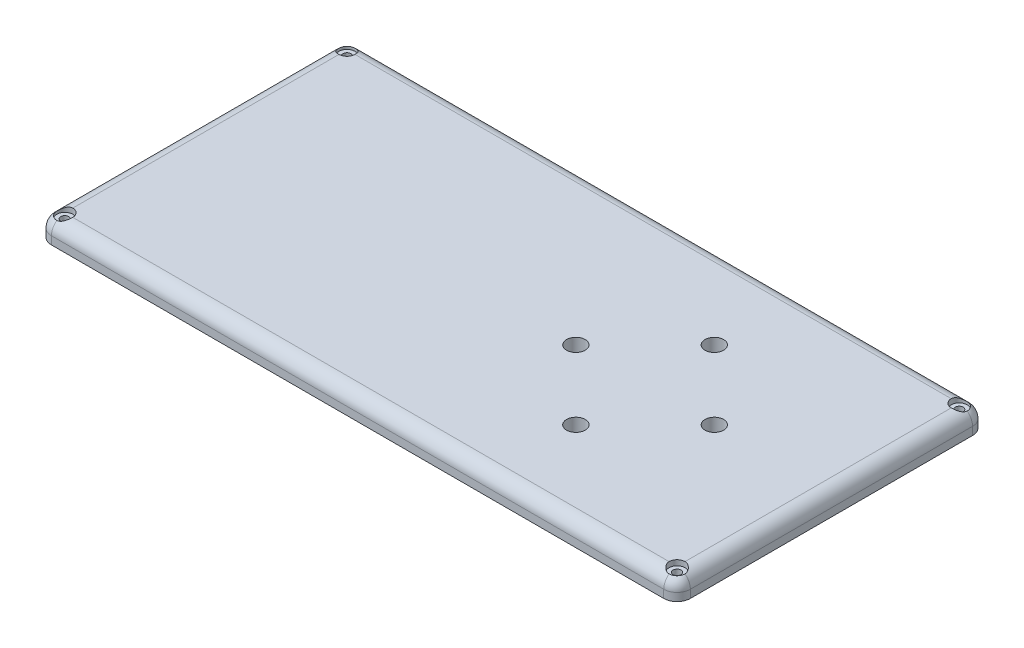
from build123d import *

# Parameters (mm, degrees)
SKETCH1_W           = 240
SKETCH1_H           = 116
BOSS_EXTRUDE1_DEPTH = 8
FILLET1_R           = 5
CUT_EXTRUDE1_REACH  = 135.522
SKETCH2_R           = 1.5
FILLET2_R           = 5
SKETCH3_R           = 3
SKETCH3_R_2         = 1.5
CUT_EXTRUDE2_DEPTH  = 2
SHELL1_DEPTH        = 3
SHELL1_2_DEPTH      = 1
CUT_EXTRUDE3_REACH  = 135.522
SKETCH4_R           = 3.5


# Read off the part's stored shape, not the designer's step: Shell1
with BuildPart() as part:
    # Sketch1 → Boss-Extrude1 (new body)
    with BuildSketch(Plane(origin=(0, 0, 0), x_dir=(1, 0, 0), z_dir=(0, 1, 0))):
        Rectangle(SKETCH1_W, SKETCH1_H)
    extrude(amount=BOSS_EXTRUDE1_DEPTH)

    # Fillet1
    fillet1_edges = [part.edges().sort_by_distance(p)[0] for p in [
        (120, 4, 58),
        (-120, 4, 58),
        (-120, 4, -58),
        (120, 4, -58),
    ]]
    fillet(fillet1_edges, radius=FILLET1_R)

    # Sketch2 → Cut-Extrude1 (cut, up to next)
    with BuildSketch(Plane(origin=(0, 8, 0), x_dir=(1, 0, 0), z_dir=(0, 1, 0)), mode=Mode.PRIVATE) as cut_extrude1_sk1:
        with Locations(Location((-115, -53, 0), (0, 0, 270))):
            Circle(SKETCH2_R)
    cut_extrude1_tool1 = extrude(cut_extrude1_sk1.sketch, amount=-CUT_EXTRUDE1_REACH, mode=Mode.PRIVATE) & part.part
    # Sketch2 → Cut-Extrude1 (cut, up to next)
    with BuildSketch(Plane(origin=(0, 8, 0), x_dir=(1, 0, 0), z_dir=(0, 1, 0)), mode=Mode.PRIVATE) as cut_extrude1_sk2:
        with Locations(Location((-115, 53, 0), (0, 0, 270))):
            Circle(SKETCH2_R)
    cut_extrude1_tool2 = extrude(cut_extrude1_sk2.sketch, amount=-CUT_EXTRUDE1_REACH, mode=Mode.PRIVATE) & part.part
    # Sketch2 → Cut-Extrude1 (cut, up to next)
    with BuildSketch(Plane(origin=(0, 8, 0), x_dir=(1, 0, 0), z_dir=(0, 1, 0)), mode=Mode.PRIVATE) as cut_extrude1_sk3:
        with Locations(Location((115, 53, 0), (0, 0, 270))):
            Circle(SKETCH2_R)
    cut_extrude1_tool3 = extrude(cut_extrude1_sk3.sketch, amount=-CUT_EXTRUDE1_REACH, mode=Mode.PRIVATE) & part.part
    # Sketch2 → Cut-Extrude1 (cut, up to next)
    with BuildSketch(Plane(origin=(0, 8, 0), x_dir=(1, 0, 0), z_dir=(0, 1, 0)), mode=Mode.PRIVATE) as cut_extrude1_sk4:
        with Locations(Location((115, -53, 0), (0, 0, 270))):
            Circle(SKETCH2_R)
    cut_extrude1_tool4 = extrude(cut_extrude1_sk4.sketch, amount=-CUT_EXTRUDE1_REACH, mode=Mode.PRIVATE) & part.part
    add(cut_extrude1_tool1.solids().sort_by_distance((-115, 8, 53))[0], mode=Mode.SUBTRACT)
    add(cut_extrude1_tool2.solids().sort_by_distance((-115, 8, -53))[0], mode=Mode.SUBTRACT)
    add(cut_extrude1_tool3.solids().sort_by_distance((115, 8, -53))[0], mode=Mode.SUBTRACT)
    add(cut_extrude1_tool4.solids().sort_by_distance((115, 8, 53))[0], mode=Mode.SUBTRACT)

    # Fillet2
    # the kernel refuses this fillet: 5 mm, written as the material it takes off along each edge
    with BuildSketch(Plane(origin=(-115, 8, -58), x_dir=(0, -1, 0), z_dir=(1, 0, 0))) as fillet2_piece_1:
        with BuildLine():
            CenterArc((FILLET2_R, -FILLET2_R), FILLET2_R, 90, 90)
            Line((0, -FILLET2_R), (0, 0))
            Line((0, 0), (FILLET2_R, 0))
        make_face()
    extrude(amount=230, mode=Mode.SUBTRACT)
    with BuildSketch(Plane(origin=(120, 8, -53), x_dir=(-1, 0, 0), z_dir=(0, 0, 1)), Plane(origin=(-120, 8, 53), x_dir=(1, 0, 0), z_dir=(0, 0, -1))) as fillet2_piece_2:
        with BuildLine():
            CenterArc((FILLET2_R, FILLET2_R), FILLET2_R, 180, 90)
            Line((0, FILLET2_R), (0, 0))
            Line((0, 0), (FILLET2_R, 0))
        make_face()
    extrude(amount=106, mode=Mode.SUBTRACT)
    with BuildSketch(Plane(origin=(115, 8, 58), x_dir=(0, 0, -1), z_dir=(-1, 0, 0))) as fillet2_piece_3:
        with BuildLine():
            CenterArc((FILLET2_R, FILLET2_R), FILLET2_R, 180, 90)
            Line((0, FILLET2_R), (0, 0))
            Line((0, 0), (FILLET2_R, 0))
        make_face()
    extrude(amount=230, mode=Mode.SUBTRACT)
    with BuildSketch(Plane(origin=(-115, 8, 53), x_dir=(0, 0, 1), z_dir=(1, 0, 0))) as fillet2_piece_4:
        with BuildLine():
            CenterArc((5 - FILLET2_R, FILLET2_R), FILLET2_R, 270, 90)
            Line((5, FILLET2_R), (5, 0))
            Line((5, 0), (5 - FILLET2_R, 0))
        make_face()
    revolve(axis=Axis((-115, 8, 53), (0, -1, 0)), revolution_arc=90, mode=Mode.SUBTRACT)
    with BuildSketch(Plane(origin=(-115, 8, -53), x_dir=(0, 0, -1), z_dir=(1, 0, 0))) as fillet2_piece_5:
        with BuildLine():
            CenterArc((5 - FILLET2_R, -FILLET2_R), FILLET2_R, 0, 90)
            Line((5 - FILLET2_R, 0), (5, 0))
            Line((5, 0), (5, -FILLET2_R))
        make_face()
    revolve(axis=Axis((-115, 8, -53), (0, 1, 0)), revolution_arc=90, mode=Mode.SUBTRACT)
    with BuildSketch(Plane(origin=(115, 8, 53), x_dir=(1, 0, 0), z_dir=(0, 0, -1))) as fillet2_piece_6:
        with BuildLine():
            CenterArc((5 - FILLET2_R, FILLET2_R), FILLET2_R, 270, 90)
            Line((5, FILLET2_R), (5, 0))
            Line((5, 0), (5 - FILLET2_R, 0))
        make_face()
    revolve(axis=Axis((115, 8, 53), (0, -1, 0)), revolution_arc=90, mode=Mode.SUBTRACT)
    with BuildSketch(Plane(origin=(115, 8, -53), x_dir=(0, 0, -1), z_dir=(-1, 0, 0))) as fillet2_piece_7:
        with BuildLine():
            CenterArc((5 - FILLET2_R, FILLET2_R), FILLET2_R, 270, 90)
            Line((5 - FILLET2_R, 0), (5, 0))
            Line((5, 0), (5, FILLET2_R))
        make_face()
    revolve(axis=Axis((115, 8, -53), (0, -1, 0)), revolution_arc=90, mode=Mode.SUBTRACT)

    # Sketch3 → Cut-Extrude2 (cut)
    # profile 1 of 4: a face of its own
    with BuildSketch(Plane(origin=(0, 8, 0), x_dir=(1, 0, 0), z_dir=(0, 1, 0))):
        with Locations(Location((-115, 53, 0), (0, 0, 270))):
            Circle(SKETCH3_R)
        with Locations(Location((-115, 53, 0), (0, 0, 270))):
            Circle(SKETCH3_R_2, mode=Mode.SUBTRACT)
    # profile 2 of 4: a face of its own
    with BuildSketch(Plane(origin=(0, 8, 0), x_dir=(1, 0, 0), z_dir=(0, 1, 0))):
        with Locations(Location((-115, -53, 0), (0, 0, 90))):
            Circle(SKETCH3_R)
        with Locations(Location((-115, -53, 0), (0, 0, 270))):
            Circle(SKETCH3_R_2, mode=Mode.SUBTRACT)
    # profile 3 of 4: a face of its own
    with BuildSketch(Plane(origin=(0, 8, 0), x_dir=(1, 0, 0), z_dir=(0, 1, 0))):
        with Locations(Location((115, -53, 0), (0, 0, 270))):
            Circle(SKETCH3_R)
        with Locations(Location((115, -53, 0), (0, 0, 270))):
            Circle(SKETCH3_R_2, mode=Mode.SUBTRACT)
    # profile 4 of 4: a face of its own
    with BuildSketch(Plane(origin=(0, 8, 0), x_dir=(1, 0, 0), z_dir=(0, 1, 0))):
        with Locations(Location((115, 53, 0), (0, 0, 90))):
            Circle(SKETCH3_R)
        with Locations(Location((115, 53, 0), (0, 0, 270))):
            Circle(SKETCH3_R_2, mode=Mode.SUBTRACT)
    extrude(amount=-CUT_EXTRUDE2_DEPTH, mode=Mode.SUBTRACT)

    # Shell1 outline → Shell1 (cut)
    with BuildSketch(Plane(origin=(0, 0, 0), x_dir=(1, 0, 0), z_dir=(0, 1, 0))):
        with BuildLine():
            ThreePointArc((-107, 53), (-109.343145751, 47.343145751), (-115, 45))
            Line((-115, 45), (-115, -45))
            ThreePointArc((-115, -45), (-109.343145751, -47.343145751), (-107, -53))
            Line((-107, -53), (107, -53))
            ThreePointArc((107, -53), (109.343145751, -47.343145751), (115, -45))
            Line((115, -45), (115, 45))
            ThreePointArc((115, 45), (109.343145751, 47.343145751), (107, 53))
            Line((107, 53), (-107, 53))
        make_face()
    extrude(amount=SHELL1_DEPTH, mode=Mode.SUBTRACT)

    # Shell1 2 outline → Shell1 2 (cut)
    with BuildSketch(Plane(origin=(0, 0, 0), x_dir=(1, 0, 0), z_dir=(0, 1, 0))):
        with BuildLine():
            Line((-115, 46.5), (-115, 45))
            ThreePointArc((-115, 45), (-109.343145751, 47.343145751), (-107, 53))
            Line((-107, 53), (-108.5, 53))
            ThreePointArc((-108.5, 53), (-110.403805922, 48.403805922), (-115, 46.5))
        make_face()
        with BuildLine():
            ThreePointArc((-107, -53), (-109.343145751, -47.343145751), (-115, -45))
            Line((-115, -45), (-115, -46.5))
            ThreePointArc((-115, -46.5), (-110.403805922, -48.403805922), (-108.5, -53))
            Line((-108.5, -53), (-107, -53))
        make_face()
        with BuildLine():
            Line((108.5, 53), (107, 53))
            ThreePointArc((107, 53), (109.343145751, 47.343145751), (115, 45))
            Line((115, 45), (115, 46.5))
            ThreePointArc((115, 46.5), (110.403805922, 48.403805922), (108.5, 53))
        make_face()
        with BuildLine():
            ThreePointArc((115, -45), (109.343145751, -47.343145751), (107, -53))
            Line((107, -53), (108.5, -53))
            ThreePointArc((108.5, -53), (110.403805922, -48.403805922), (115, -46.5))
            Line((115, -46.5), (115, -45))
        make_face()
    extrude(amount=SHELL1_2_DEPTH, mode=Mode.SUBTRACT)

    # Sketch4 → Cut-Extrude3 (cut, up to next)
    with BuildSketch(Plane(origin=(0, 8, 0), x_dir=(1, 0, 0), z_dir=(0, 1, 0)), mode=Mode.PRIVATE) as cut_extrude3_sk1:
        with Locations(Location((24, 0, 0), (0, 0, 270))):
            Circle(SKETCH4_R)
    cut_extrude3_tool1 = extrude(cut_extrude3_sk1.sketch, amount=-CUT_EXTRUDE3_REACH, mode=Mode.PRIVATE) & part.part
    # Sketch4 → Cut-Extrude3 (cut, up to next)
    with BuildSketch(Plane(origin=(0, 8, 0), x_dir=(1, 0, 0), z_dir=(0, 1, 0)), mode=Mode.PRIVATE) as cut_extrude3_sk2:
        with Locations(Location((50, 26, 0), (0, 0, 270))):
            Circle(SKETCH4_R)
    cut_extrude3_tool2 = extrude(cut_extrude3_sk2.sketch, amount=-CUT_EXTRUDE3_REACH, mode=Mode.PRIVATE) & part.part
    # Sketch4 → Cut-Extrude3 (cut, up to next)
    with BuildSketch(Plane(origin=(0, 8, 0), x_dir=(1, 0, 0), z_dir=(0, 1, 0)), mode=Mode.PRIVATE) as cut_extrude3_sk3:
        with Locations(Location((76, 0, 0), (0, 0, 270))):
            Circle(SKETCH4_R)
    cut_extrude3_tool3 = extrude(cut_extrude3_sk3.sketch, amount=-CUT_EXTRUDE3_REACH, mode=Mode.PRIVATE) & part.part
    # Sketch4 → Cut-Extrude3 (cut, up to next)
    with BuildSketch(Plane(origin=(0, 8, 0), x_dir=(1, 0, 0), z_dir=(0, 1, 0)), mode=Mode.PRIVATE) as cut_extrude3_sk4:
        with Locations(Location((50, -26, 0), (0, 0, 270))):
            Circle(SKETCH4_R)
    cut_extrude3_tool4 = extrude(cut_extrude3_sk4.sketch, amount=-CUT_EXTRUDE3_REACH, mode=Mode.PRIVATE) & part.part
    add(cut_extrude3_tool1.solids().sort_by_distance((24, 8, 0))[0], mode=Mode.SUBTRACT)
    add(cut_extrude3_tool2.solids().sort_by_distance((50, 8, -26))[0], mode=Mode.SUBTRACT)
    add(cut_extrude3_tool3.solids().sort_by_distance((76, 8, 0))[0], mode=Mode.SUBTRACT)
    add(cut_extrude3_tool4.solids().sort_by_distance((50, 8, 26))[0], mode=Mode.SUBTRACT)


solid = part.part
